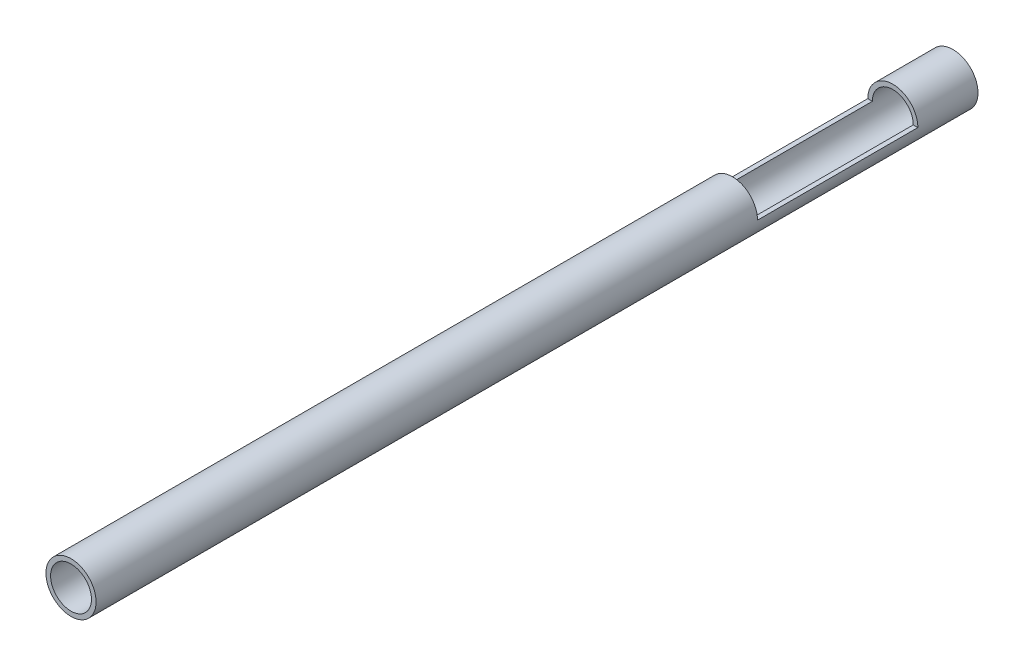
from build123d import *

# Parameters (mm, degrees)
SKETCH2_R           = 15.875
SKETCH2_R_2         = 12.954
BOSS_EXTRUDE1_DEPTH = 558.8
CUT_EXTRUDE1_REACH  = 561.251
SKETCH3_W           = 50.8
SKETCH3_H           = 101.6


with BuildPart() as part:
    # Sketch2 → Boss-Extrude1 (new body)
    with BuildSketch(Plane.XY):
        Circle(SKETCH2_R)
        Circle(SKETCH2_R_2, mode=Mode.SUBTRACT)
    extrude(amount=BOSS_EXTRUDE1_DEPTH)

    # Sketch3 → Cut-Extrude1 (cut, up to next)
    with BuildSketch(Plane(origin=(0, 0, 0), x_dir=(1, 0, 0), z_dir=(0, 1, 0)), mode=Mode.PRIVATE) as cut_extrude1_sk1:
        with Locations((0, -88.9)):
            Rectangle(SKETCH3_W, SKETCH3_H)
    cut_extrude1_tool1 = extrude(cut_extrude1_sk1.sketch, amount=CUT_EXTRUDE1_REACH, mode=Mode.PRIVATE) & part.part
    add(cut_extrude1_tool1.solids().sort_by_distance((0, 0, 88.9))[0], mode=Mode.SUBTRACT)


solid = part.part
